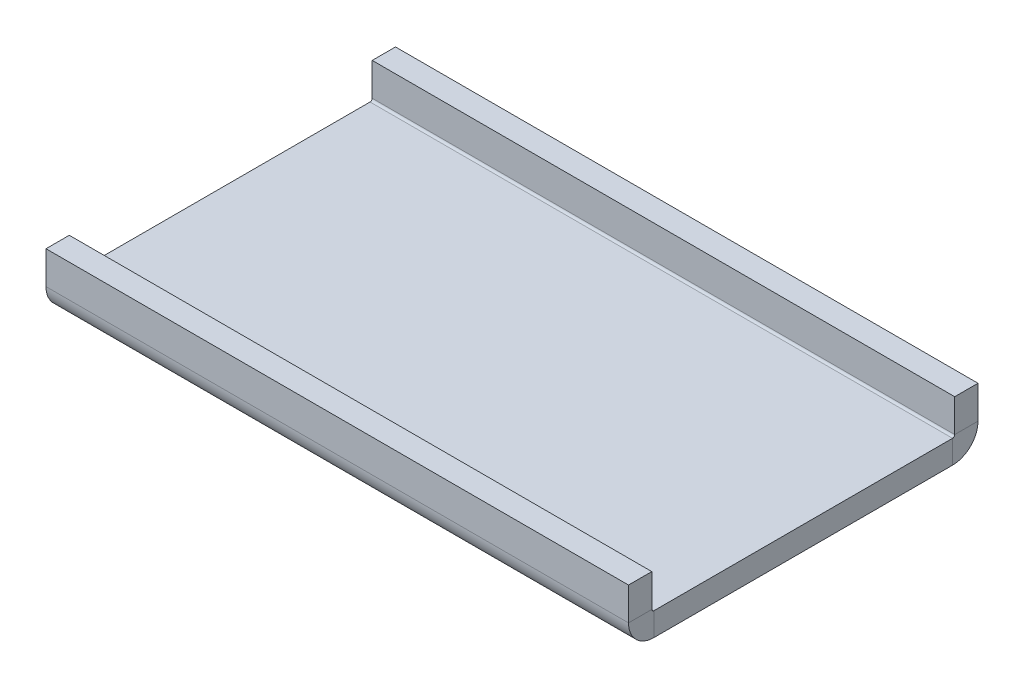
from build123d import *

# Parameters (mm, degrees)
SM_START                         = -4
SM_BASE_FLANGE_1_OUTLINE_W       = 200
SM_BASE_FLANGE_1_OUTLINE_H       = 120
SM_BASE_FLANGE_1_DEPTH           = 8
SM_EDGE_FLANGE_1_STRIP_W         = 33.4732
SM_EDGE_FLANGE_1_STRIP_H         = 8
SM_EDGE_FLANGE_1_STRIP_CUT_DEPTH = 200
SM_EDGE_FLANGE_1_DEPTH           = 200
SM_EDGE_FLANGE_2_STRIP_W         = 33.4732
SM_EDGE_FLANGE_2_STRIP_H         = 8
SM_EDGE_FLANGE_2_STRIP_CUT_DEPTH = 200
SM_EDGE_FLANGE_2_DEPTH           = 200


# Read off the part's stored shape, not the designer's step: 基体-法兰1
# Sheet-metal steps are written as plain solids
with BuildPart() as part:
    # 基体-法兰1 outline → 基体-法兰1 (new body)
    with BuildSketch(Plane(origin=(0, 0, 0), x_dir=(1, 0, 0), z_dir=(0, 1, 0)).offset(SM_START)):
        with Locations((0, 60)):
            Rectangle(SM_BASE_FLANGE_1_OUTLINE_W, SM_BASE_FLANGE_1_OUTLINE_H)
    extrude(amount=SM_BASE_FLANGE_1_DEPTH)

    # 边线-法兰1 strip (across the edge) → 边线-法兰1 strip cut (cut)
    with BuildSketch(Plane(origin=(-100, 4, 0), x_dir=(0, 0, -1), z_dir=(1, 0, 0))):
        with Locations((-8, -4)):
            Rectangle(SM_EDGE_FLANGE_1_STRIP_W, SM_EDGE_FLANGE_1_STRIP_H)
    extrude(amount=SM_EDGE_FLANGE_1_STRIP_CUT_DEPTH, mode=Mode.SUBTRACT)

    # 边线-法兰1 section (across the edge) → 边线-法兰1 (add)
    with BuildSketch(Plane(origin=(-100, 4, 0), x_dir=(0, 0, -1), z_dir=(1, 0, 0))):
        with BuildLine():
            Line((0, 0.7366), (0, 12))
            Line((0, 12), (8, 12))
            Line((8, 12), (8, 0.7366))
            ThreePointArc((8, 0.7366), (8.215745145, 0.215745145), (8.7366, 0))
            Line((8.7366, 0), (8.7366, -8))
            ThreePointArc((8.7366, -8), (2.558890895, -5.441109105), (0, 0.7366))
        make_face()
    extrude(amount=SM_EDGE_FLANGE_1_DEPTH)

    # 边线-法兰2 strip (across the edge) → 边线-法兰2 strip cut (cut)
    with BuildSketch(Plane(origin=(100, 4, -120), x_dir=(0, 0, 1), z_dir=(-1, 0, 0))):
        with Locations((-8, -4)):
            Rectangle(SM_EDGE_FLANGE_2_STRIP_W, SM_EDGE_FLANGE_2_STRIP_H)
    extrude(amount=SM_EDGE_FLANGE_2_STRIP_CUT_DEPTH, mode=Mode.SUBTRACT)

    # 边线-法兰2 section (across the edge) → 边线-法兰2 (add)
    with BuildSketch(Plane(origin=(100, 4, -120), x_dir=(0, 0, 1), z_dir=(-1, 0, 0))):
        with BuildLine():
            Line((0, 0.7366), (0, 12))
            Line((0, 12), (8, 12))
            Line((8, 12), (8, 0.7366))
            ThreePointArc((8, 0.7366), (8.215745145, 0.215745145), (8.7366, 0))
            Line((8.7366, 0), (8.7366, -8))
            ThreePointArc((8.7366, -8), (2.558890895, -5.441109105), (0, 0.7366))
        make_face()
    extrude(amount=SM_EDGE_FLANGE_2_DEPTH)


solid = part.part
